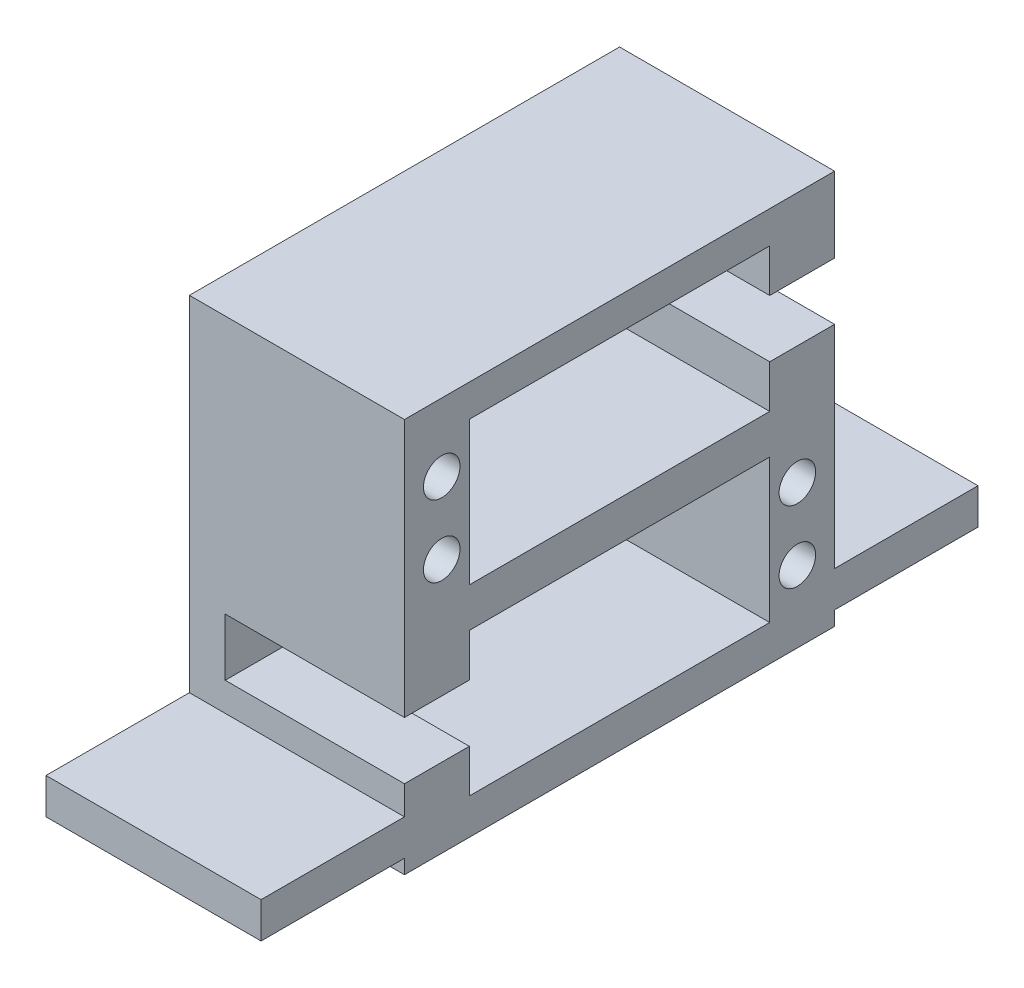
from build123d import *

# Parameters (mm, degrees)
SKETCH1_W                 = 43
SKETCH1_H                 = 60
BOSS_EXTRUDE1_DEPTH       = 55
SKETCH2_W                 = 41.9
SKETCH2_H                 = 20
CUT_EXTRUDE1_DEPTH        = 38
SKETCH3_W                 = 9.05
SKETCH3_H                 = 8
CUT_EXTRUDE2_DEPTH        = 38
SKETCH4_W                 = 60
SKETCH4_H                 = 55
CUT_EXTRUDE3_DEPTH        = 13
BOSS_EXTRUDE5_START       = -0.874015748
BOSS_EXTRUDE5_OUTLINE_W   = 2
BOSS_EXTRUDE5_OUTLINE_H   = 41.9
BOSS_EXTRUDE5_OUTLINE_W_2 = 5
BOSS_EXTRUDE5_OUTLINE_H_2 = 20
BOSS_EXTRUDE5_DEPTH       = 30
SKETCH12_R                = 2.55
CUT_EXTRUDE4_DEPTH        = 10
SKETCH13_R                = 2.55
CUT_EXTRUDE5_DEPTH        = 10
SKETCH15_W                = 41.9
SKETCH15_H                = 5
CUT_EXTRUDE7_DEPTH        = 25
SKETCH16_W                = 41.9
SKETCH16_H                = 3
BOSS_EXTRUDE6_DEPTH       = 25


# Read off the part's stored shape, not the designer's step: Boss-Extrude5
with BuildPart() as part:
    # Sketch1 → Boss-Extrude1 (new body)
    with BuildSketch(Plane(origin=(0, 0, 0), x_dir=(1, 0, 0), z_dir=(0, 1, 0))):
        with Locations((20.625984252, 7.362204724)):
            Rectangle(SKETCH1_W, SKETCH1_H)
    extrude(amount=BOSS_EXTRUDE1_DEPTH)

    # Sketch2 → Cut-Extrude1 (cut)
    with BuildSketch(Plane(origin=(42.125984252, 0, 0), x_dir=(0, 0, -1), z_dir=(1, 0, 0))):
        with Locations((7.362204724, 40.5)):
            Rectangle(SKETCH2_W, SKETCH2_H)
        with Locations((7.362204724, 15)):
            Rectangle(SKETCH2_W, SKETCH2_H)
    extrude(amount=-CUT_EXTRUDE1_DEPTH, mode=Mode.SUBTRACT)

    # Sketch3 → Cut-Extrude2 (cut)
    with BuildSketch(Plane(origin=(42.125984252, 0, 0), x_dir=(0, 0, -1), z_dir=(1, 0, 0))):
        with Locations((-18.112795276, 15)):
            Rectangle(SKETCH3_W, SKETCH3_H)
        with Locations((32.837204724, 40.5)):
            Rectangle(SKETCH3_W, SKETCH3_H)
    extrude(amount=-CUT_EXTRUDE2_DEPTH, mode=Mode.SUBTRACT)

    # Sketch4 → Cut-Extrude3 (cut)
    with BuildSketch(Plane(origin=(42.125984252, 0, 0), x_dir=(0, 0, -1), z_dir=(1, 0, 0))):
        with Locations((7.362204724, 27.5)):
            Rectangle(SKETCH4_W, SKETCH4_H)
    extrude(amount=-CUT_EXTRUDE3_DEPTH, mode=Mode.SUBTRACT)

    # Boss-Extrude5 outline → Boss-Extrude5 (add)
    with BuildSketch(Plane.YZ.offset(BOSS_EXTRUDE5_START)):
        with Locations((6, -7.362204724)):
            Rectangle(BOSS_EXTRUDE5_OUTLINE_W, BOSS_EXTRUDE5_OUTLINE_H)
        with Locations((4.5, -47.362204724)):
            Rectangle(BOSS_EXTRUDE5_OUTLINE_W_2, BOSS_EXTRUDE5_OUTLINE_H_2)
        with Locations((4.5, 32.637795276)):
            Rectangle(BOSS_EXTRUDE5_OUTLINE_W_2, BOSS_EXTRUDE5_OUTLINE_H_2)
    extrude(amount=BOSS_EXTRUDE5_DEPTH)

    # Sketch12 → Cut-Extrude4 (cut)
    with BuildSketch(Plane(origin=(29.125984252, 0, 0), x_dir=(0, 0, -1), z_dir=(1, 0, 0))):
        with Locations((-17.437795276, 45.5)):
            Circle(SKETCH12_R)
        with Locations((-17.437795276, 35.5)):
            Circle(SKETCH12_R)
    extrude(amount=-CUT_EXTRUDE4_DEPTH, mode=Mode.SUBTRACT)

    # Sketch13 → Cut-Extrude5 (cut)
    with BuildSketch(Plane(origin=(29.125984252, 0, 0), x_dir=(0, 0, -1), z_dir=(1, 0, 0))):
        with Locations((32.162204724, 20)):
            Circle(SKETCH13_R)
        with Locations((32.162204724, 10)):
            Circle(SKETCH13_R)
    extrude(amount=-CUT_EXTRUDE5_DEPTH, mode=Mode.SUBTRACT)

    # Sketch15 → Cut-Extrude7 (cut)
    with BuildSketch(Plane(origin=(29.125984252, 0, 0), x_dir=(0, 0, -1), z_dir=(1, 0, 0))):
        with Locations((7.362204724, 4.5)):
            Rectangle(SKETCH15_W, SKETCH15_H)
    extrude(amount=-CUT_EXTRUDE7_DEPTH, mode=Mode.SUBTRACT)

    # Sketch16 → Boss-Extrude6 (add)
    with BuildSketch(Plane(origin=(4.125984252, 0, 0), x_dir=(0, 0, -1), z_dir=(1, 0, 0))):
        with Locations((7.362204724, 3.5)):
            Rectangle(SKETCH16_W, SKETCH16_H)
    extrude(amount=BOSS_EXTRUDE6_DEPTH)


solid = part.part
